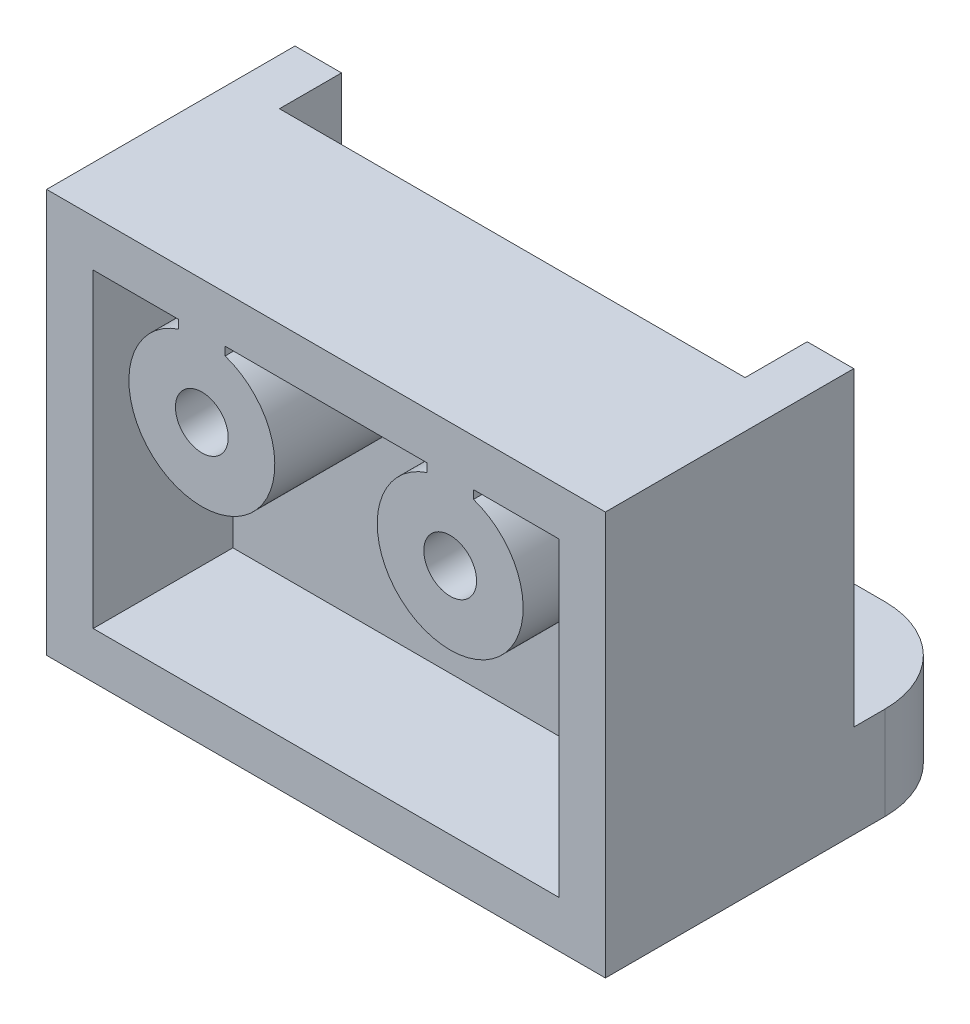
from build123d import *

# Parameters (mm, degrees)
EXTRUDE_1_DEPTH     = 30
SKETCH_2_W          = 18
SKETCH_2_H          = 28
SKETCH_2_R          = 1.6
EXTRUDE_2_DEPTH     = 3
SKETCH_3_W          = 1.1
SKETCH_3_H          = 6
CUT_EXTRUDE_1_DEPTH = 15
FILLET_1_R          = 3
EXTRUDE_3_DEPTH     = 1.5
SKETCH_6_W          = 8
SKETCH_6_H          = 7.1
EXTRUDE_4_DEPTH     = 30
SKETCH_7_W          = 18
SKETCH_7_H          = 30
CUT_EXTRUDE_3_DEPTH = 10.5
EXTRUDE_5_DEPTH     = 10
CUT_EXTRUDE_5_REACH = 24.392
SKETCH_9_W          = 18
SKETCH_9_H          = 16
CUT_EXTRUDE_6_REACH = 16.731
SKETCH_11_R         = 0.85
SHELL_START         = -20.5
SHELL_1_OUTLINE_W   = 15
SHELL_1_OUTLINE_H   = 10
SHELL_1_OUTLINE_R   = 2.35
SHELL_1_DEPTH       = 4.5
RIB_1_REACH         = 20.028
SKETCH_12_WALLS_W   = 1.5
SKETCH_12_WALLS_H   = 42.055512754


# Read off the part's stored shape, not the designer's step: 抽壳1
with BuildPart() as part:
    # 草图1 → 凸台-拉伸1 (new body)
    with BuildSketch(Plane(origin=(0, 0, 0), x_dir=(1, 0, 0), z_dir=(0, 1, 0))):
        Polygon((-9, 10.1), (-9, 0), (9, 0), (9, 10.1), (4, 10.1), (4, 3), (-4, 3), (-4, 10.1), align=None)
    extrude(amount=EXTRUDE_1_DEPTH)

    # 草图2 → 凸台-拉伸2 (add)
    with BuildSketch(Plane.XZ):
        with Locations((0, -14)):
            Rectangle(SKETCH_2_W, SKETCH_2_H)
        with Locations(Location((4, -25, 0), (0, 0, 270))):
            Circle(SKETCH_2_R, mode=Mode.SUBTRACT)
        with Locations(Location((-4, -25, 0), (0, 0, 270))):
            Circle(SKETCH_2_R, mode=Mode.SUBTRACT)
    extrude(amount=EXTRUDE_2_DEPTH)

    # 草图3 → 切除-拉伸1 (cut)
    with BuildSketch(Plane(origin=(0, 30, 0), x_dir=(1, 0, 0), z_dir=(0, 1, 0))):
        with Locations((-6.95, 7.1)):
            Rectangle(SKETCH_3_W, SKETCH_3_H)
        with Locations((6.95, 7.1)):
            Rectangle(SKETCH_3_W, SKETCH_3_H)
    extrude(amount=-CUT_EXTRUDE_1_DEPTH, mode=Mode.SUBTRACT)

    # 圆角1
    fillet_1_edges = [part.edges().sort_by_distance(p)[0] for p in [
        (9, -1.5, -28),
        (-9, -1.5, -28),
    ]]
    fillet(fillet_1_edges, radius=FILLET_1_R)

    # 草图5 → 凸台-拉伸3 (add)
    with BuildSketch(Plane.ZY.offset(9)):
        Polygon((-10.1, 0), (-10.1, 6), (-15.1, 0), align=None)
    extrude_3 = extrude(amount=-EXTRUDE_3_DEPTH)

    # 镜向1: 凸台-拉伸3 across plane
    add(extrude_3.mirror(Plane(origin=(0, 0, 0), x_dir=(0, 0, 1), z_dir=(1, 0, 0))))

    # 草图6 → 凸台-拉伸4 (add)
    with BuildSketch(Plane(origin=(0, 0, 0), x_dir=(1, 0, 0), z_dir=(0, 1, 0))):
        with Locations((0, 6.55)):
            Rectangle(SKETCH_6_W, SKETCH_6_H)
    extrude(amount=EXTRUDE_4_DEPTH)

    # 草图7 → 切除-拉伸3 (cut, symmetric)
    with BuildSketch(Plane(origin=(0, 0, -10.1), x_dir=(-1, 0, 0), z_dir=(0, 0, -1))):
        with Locations((0, 15)):
            Rectangle(SKETCH_7_W, SKETCH_7_H)
    extrude(amount=CUT_EXTRUDE_3_DEPTH, both=True, mode=Mode.SUBTRACT)

    # 草图10 → 凸台-拉伸5 (add)
    with BuildSketch(Plane(origin=(0, 0, 0), x_dir=(1, 0, 0), z_dir=(0, 1, 0))):
        Polygon((9, 16), (-9, 16), (-9, 24), (-7.5, 24), (-7.5, 22), (7.5, 22), (7.5, 24), (9, 24), align=None)
    extrude(amount=EXTRUDE_5_DEPTH)

    # 草图9 → 切除-拉伸5 (cut, up to next)
    with BuildSketch(Plane(origin=(0, 0, -10.1), x_dir=(-1, 0, 0), z_dir=(0, 1, 0)), mode=Mode.PRIVATE) as cut_extrude_5_sk1:
        with Locations((0, 2.1)):
            Rectangle(SKETCH_9_W, SKETCH_9_H)
    cut_extrude_5_tool1 = extrude(cut_extrude_5_sk1.sketch, amount=-CUT_EXTRUDE_5_REACH, mode=Mode.PRIVATE) & part.part
    add(cut_extrude_5_tool1.solids().sort_by_distance((0, 0, -8))[0], mode=Mode.SUBTRACT)

    # 草图11 → 切除-拉伸6 (cut, up to next)
    with BuildSketch(Plane(origin=(0, 0, -22), x_dir=(-1, 0, 0), z_dir=(0, 0, -1)), mode=Mode.PRIVATE) as cut_extrude_6_sk1:
        with Locations((4, 6)):
            Circle(SKETCH_11_R)
    cut_extrude_6_tool1 = extrude(cut_extrude_6_sk1.sketch, amount=-CUT_EXTRUDE_6_REACH, mode=Mode.PRIVATE) & part.part
    # 草图11 → 切除-拉伸6 (cut, up to next)
    with BuildSketch(Plane(origin=(0, 0, -22), x_dir=(-1, 0, 0), z_dir=(0, 0, -1)), mode=Mode.PRIVATE) as cut_extrude_6_sk2:
        with Locations((-4, 6)):
            Circle(SKETCH_11_R)
    cut_extrude_6_tool2 = extrude(cut_extrude_6_sk2.sketch, amount=-CUT_EXTRUDE_6_REACH, mode=Mode.PRIVATE) & part.part
    add(cut_extrude_6_tool1.solids().sort_by_distance((-4, 6, -22))[0], mode=Mode.SUBTRACT)
    add(cut_extrude_6_tool2.solids().sort_by_distance((4, 6, -22))[0], mode=Mode.SUBTRACT)

    # 抽壳1 outline → 抽壳1 (cut)
    with BuildSketch(Plane.XY.offset(SHELL_START)):
        with Locations((0, 3.5)):
            Rectangle(SHELL_1_OUTLINE_W, SHELL_1_OUTLINE_H)
        with Locations((-4, 6)):
            Circle(SHELL_1_OUTLINE_R, mode=Mode.SUBTRACT)
        with Locations((4, 6)):
            Circle(SHELL_1_OUTLINE_R, mode=Mode.SUBTRACT)
    extrude(amount=SHELL_1_DEPTH, mode=Mode.SUBTRACT)

    # 草图12 walls → 筋1 (add, up to next)
    with BuildSketch(Plane.XY.offset(-16), mode=Mode.PRIVATE) as rib_1_sk1:
        with Locations((4, 8)):
            Rectangle(SKETCH_12_WALLS_W, SKETCH_12_WALLS_H)
    rib_1_tool1 = extrude(rib_1_sk1.sketch, amount=-RIB_1_REACH, mode=Mode.PRIVATE) - part.part
    # 草图12 walls → 筋1 (add, up to next)
    with BuildSketch(Plane.XY.offset(-16), mode=Mode.PRIVATE) as rib_1_sk2:
        with Locations((-4, 8)):
            Rectangle(SKETCH_12_WALLS_W, SKETCH_12_WALLS_H)
    rib_1_tool2 = extrude(rib_1_sk2.sketch, amount=-RIB_1_REACH, mode=Mode.PRIVATE) - part.part
    add(rib_1_tool1.solids().sort_by_distance((4, 8, -16))[0])
    add(rib_1_tool2.solids().sort_by_distance((-4, 8, -16))[0])


solid = part.part
